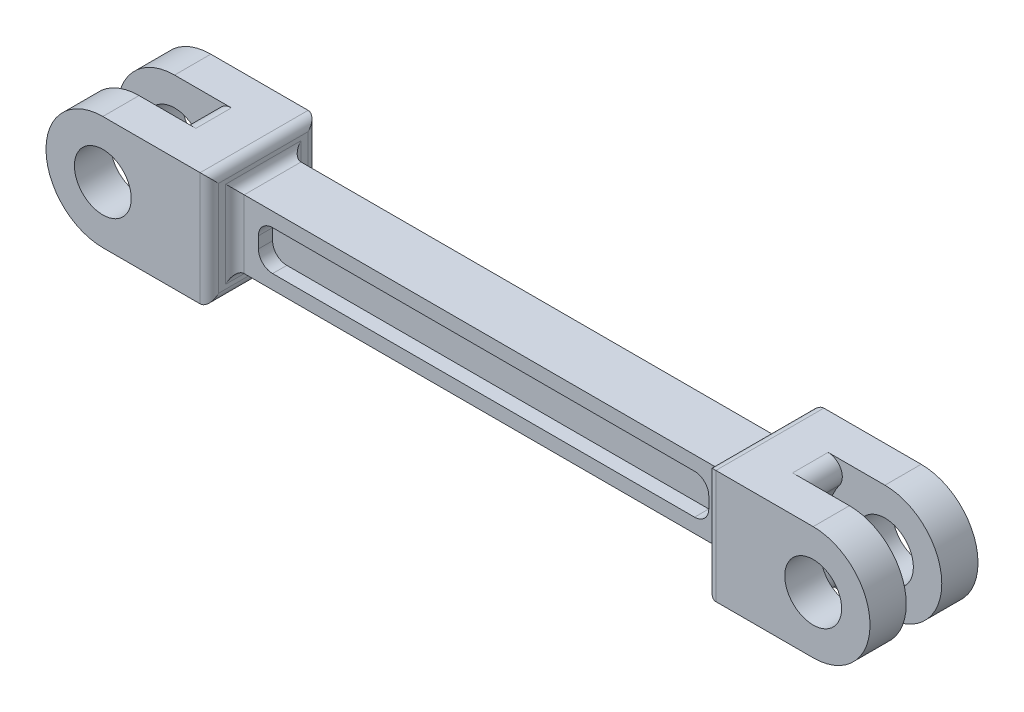
from build123d import *

# Parameters (mm, degrees)
SKETCH1_W            = 175
SKETCH1_H            = 24
BOSS_EXTRUDE3_DEPTH  = 10
SKETCH1_6_R          = 20
SKETCH1_6_R_2        = 10
HEAD_WIDTH_DEPTH     = 19
SKETCH1_7_R          = 20
SKETCH1_7_R_2        = 10
CUT_EXTRUDE1_DEPTH   = 6.25
FILLET1_START        = -6.25
FILLET1_DEPTH        = 12.5
FILLET2_R            = 3.25
SKETCH2_W            = 158.5
SKETCH2_H            = 14
CUT_EXTRUDE2_DEPTH   = 5
FILLET3_R            = 5
FILLET3_OF_MIRROR1_R = 5


with BuildPart() as part:
    # Sketch1 → Boss-Extrude3 (new, symmetric)
    with BuildSketch(Plane.XY):
        with Locations((125, 0)):
            Rectangle(SKETCH1_W, SKETCH1_H)
    extrude(amount=BOSS_EXTRUDE3_DEPTH, both=True)

    # Sketch1<6> → Head Width (add, symmetric)
    # profile 1 of 4: a face of its own
    with BuildSketch(Plane.XY):
        with BuildLine():
            Line((37.5, -12), (37.5, 12))
            Line((37.5, 12), (37.5, 20))
            Line((37.5, 20), (0, 20))
            ThreePointArc((0, 20), (14.142135624, 14.142135624), (20, 0))
            ThreePointArc((20, 0), (14.142135624, -14.142135624), (0, -20))
            Line((0, -20), (37.5, -20))
            Line((37.5, -20), (37.5, -12))
        make_face()
    # profile 2 of 4: a face of its own
    with BuildSketch(Plane.XY):
        Circle(SKETCH1_6_R)
        Circle(SKETCH1_6_R_2, mode=Mode.SUBTRACT)
    # profile 3 of 4: a face of its own
    with BuildSketch(Plane.XY):
        with BuildLine():
            Line((212.5, 20), (212.5, 12))
            Line((212.5, 12), (212.5, -12))
            Line((212.5, -12), (212.5, -20))
            Line((212.5, -20), (250, -20))
            ThreePointArc((250, -20), (230, 0), (250, 20))
            Line((250, 20), (212.5, 20))
        make_face()
    # profile 4 of 4: a face of its own
    with BuildSketch(Plane.XY):
        with Locations((250, 0)):
            Circle(SKETCH1_6_R)
        with Locations((250, 0)):
            Circle(SKETCH1_6_R_2, mode=Mode.SUBTRACT)
    extrude(amount=HEAD_WIDTH_DEPTH, both=True)

    # Sketch1<7> → Cut-Extrude1 (cut, symmetric)
    # profile 1 of 2: a face of its own
    with BuildSketch(Plane.XY):
        Circle(SKETCH1_7_R)
        Circle(SKETCH1_7_R_2, mode=Mode.SUBTRACT)
    # profile 2 of 2: a face of its own
    with BuildSketch(Plane.XY):
        with Locations((250, 0)):
            Circle(SKETCH1_7_R)
        with Locations((250, 0)):
            Circle(SKETCH1_7_R_2, mode=Mode.SUBTRACT)
    extrude(amount=CUT_EXTRUDE1_DEPTH, both=True, mode=Mode.SUBTRACT)

    # Fillet1: read off the stored shape, not the designer's step
    # Fillet1 outline → Fillet1 (cut)
    with BuildSketch(Plane.XY.offset(FILLET1_START)):
        with BuildLine():
            ThreePointArc((230, 20), (234.472135955, 17.236067977), (234, 12))
            ThreePointArc((234, 12), (241.05572809, 17.88854382), (250, 20))
            Line((250, 20), (230, 20))
        make_face()
        with BuildLine():
            ThreePointArc((234, -12), (234.472135955, -17.236067977), (230, -20))
            Line((230, -20), (250, -20))
            ThreePointArc((250, -20), (241.05572809, -17.88854382), (234, -12))
        make_face()
        with BuildLine():
            ThreePointArc((20, -20), (15.527864045, -17.236067977), (16, -12))
            ThreePointArc((16, -12), (8.94427191, -17.88854382), (0, -20))
            Line((0, -20), (20, -20))
        make_face()
        with BuildLine():
            ThreePointArc((0, 20), (8.94427191, 17.88854382), (16, 12))
            ThreePointArc((16, 12), (15.527864045, 17.236067977), (20, 20))
            Line((20, 20), (0, 20))
        make_face()
    extrude(amount=FILLET1_DEPTH, mode=Mode.SUBTRACT)

    # Fillet2
    fillet2_edges = [part.edges().sort_by_distance(p)[0] for p in [
        (37.5, 0, 10),
        (37.5, 20, 0),
        (37.5, 0, 19),
        (37.5, -20, 0),
        (37.5, 0, -19),
        (212.5, -20, 0),
        (212.5, 0, -19),
        (212.5, 20, 0),
        (212.5, 0, 19),
        (212.5, 0, 10),
        (37.5, 0, -10),
        (212.5, 0, -10),
        (212.5, -12, 0),
        (37.5, -12, 0),
        (37.5, 12, 0),
        (212.5, 12, 0),
    ]]
    fillet(fillet2_edges, radius=FILLET2_R)

    # Sketch2 → Cut-Extrude2 (cut)
    with BuildSketch(Plane.XY.offset(10)):
        with Locations((125, 0)):
            Rectangle(SKETCH2_W, SKETCH2_H)
    cut_extrude2 = extrude(amount=-CUT_EXTRUDE2_DEPTH, mode=Mode.SUBTRACT)

    # Fillet3
    fillet3_edges = [part.edges().sort_by_distance(p)[0] for p in [
        (45.75, -7, 7.5),
        (45.75, 7, 7.5),
        (204.25, 7, 7.5),
        (204.25, -7, 7.5),
    ]]
    fillet(fillet3_edges, radius=FILLET3_R)

    # Mirror1: Cut-Extrude2 across plane
    add(cut_extrude2.mirror(Plane.XY), mode=Mode.SUBTRACT)

    # Fillet3 of Mirror1
    fillet3_of_mirror1_edges = [part.edges().sort_by_distance(p)[0] for p in [
        (45.75, -7, -7.5),
        (45.75, 7, -7.5),
        (204.25, 7, -7.5),
        (204.25, -7, -7.5),
    ]]
    fillet(fillet3_of_mirror1_edges, radius=FILLET3_OF_MIRROR1_R)


solid = part.part
